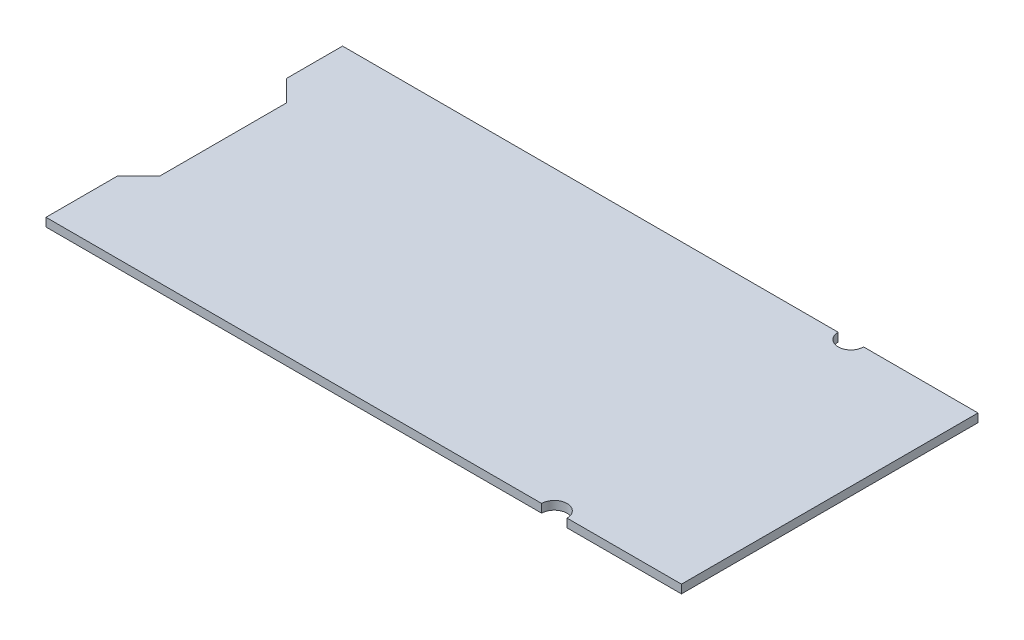
from build123d import *

# Parameters (mm, degrees)
SKETCH1_W           = 75
SKETCH1_H           = 35
BOSS_EXTRUDE1_DEPTH = 1
SKETCH2_R           = 1.5
SKETCH2_W           = 5
SKETCH2_H           = 20
CUT_EXTRUDE1_DEPTH  = 10
CHAMFER1_SIZE       = 2.5


with BuildPart() as part:
    # Sketch1 → Boss-Extrude1 (new body)
    with BuildSketch(Plane(origin=(0, 0, 0), x_dir=(1, 0, 0), z_dir=(0, 1, 0))):
        Rectangle(SKETCH1_W, SKETCH1_H)
    extrude(amount=BOSS_EXTRUDE1_DEPTH)

    # Sketch2 → Cut-Extrude1 (cut)
    with BuildSketch(Plane(origin=(0, 1, 0), x_dir=(1, 0, 0), z_dir=(0, 1, 0))):
        with Locations((22.5, 17.5)):
            Circle(SKETCH2_R)
        with Locations((22.5, -17.5)):
            Circle(SKETCH2_R)
        with Locations((-37.5, 0.89)):
            Rectangle(SKETCH2_W, SKETCH2_H)
    extrude(amount=-CUT_EXTRUDE1_DEPTH, mode=Mode.SUBTRACT)

    # Chamfer1
    chamfer1_edges = [part.edges().sort_by_distance(p)[0] for p in [
        (-35, 0.5, 9.11),
        (-35, 0.5, -10.89),
    ]]
    chamfer(chamfer1_edges, length=CHAMFER1_SIZE - 0.0001)  # a hair under: the kernel refuses the full size


solid = part.part
